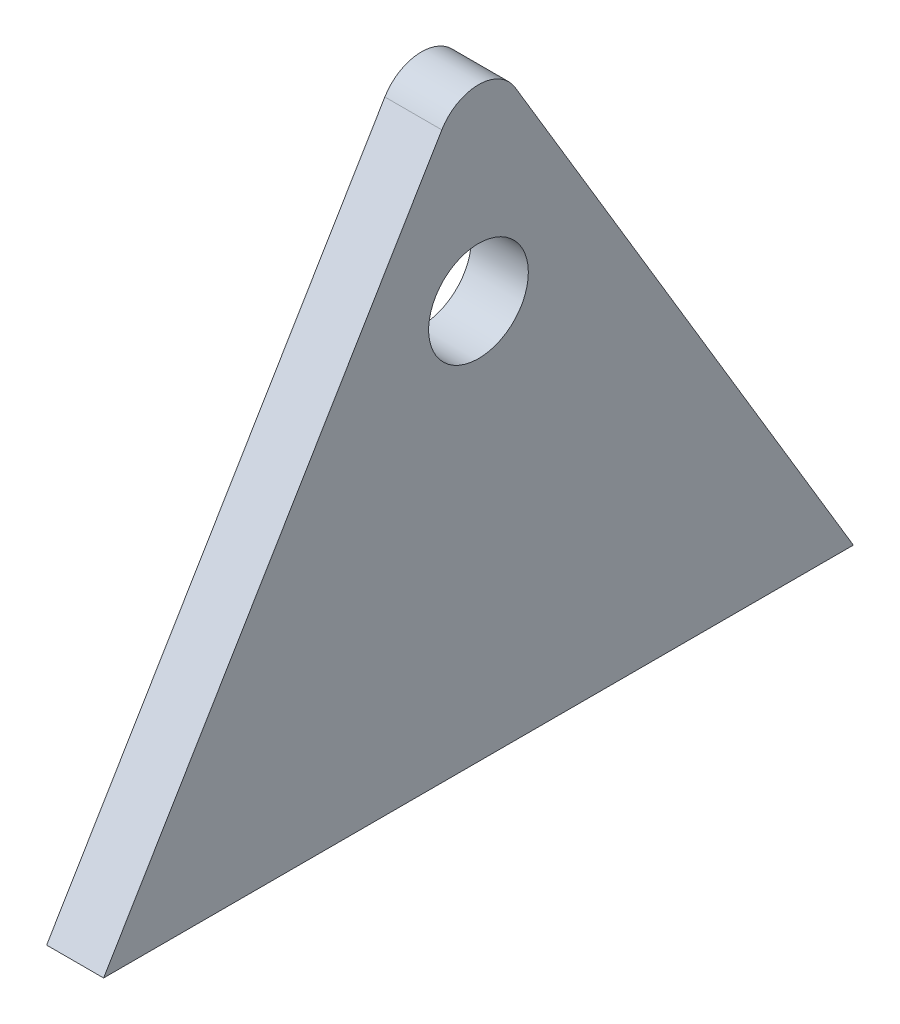
from build123d import *

# Parameters (mm, degrees)
BOSS_EXTRUDE1_DEPTH     = 12.7
FILLET1_R               = 9.525
CUT_EXTRUDE3_DEPTH      = 156.624193753
CUT_EXTRUDE3_DEPTH_BACK = 156.624193753
SKETCH2_R               = 11.1125


with BuildPart() as part:
    # Sketch1 → Boss-Extrude1 (new body)
    with BuildSketch(Plane(origin=(0, 0, 0), x_dir=(0, 0, -1), z_dir=(1, 0, 0))):
        Polygon((0, 139.7), (-83.564031322, 0), (83.564031322, 0), align=None)
    extrude(amount=BOSS_EXTRUDE1_DEPTH)

    # Fillet1
    fillet1_edges = [part.edges().sort_by_distance(p)[0] for p in [
        (6.35, 139.7, 0),
    ]]
    fillet(fillet1_edges, radius=FILLET1_R)

    # Sketch2 → Cut-Extrude3 (cut, two sides: drawn at the far end of the back side and taken through both)
    with BuildSketch(Plane(origin=(0, 0, 0), x_dir=(0, 0, -1), z_dir=(1, 0, 0)).offset(-CUT_EXTRUDE3_DEPTH_BACK)):
        with Locations((0, 88.9)):
            Circle(SKETCH2_R)
    extrude(amount=CUT_EXTRUDE3_DEPTH + CUT_EXTRUDE3_DEPTH_BACK, mode=Mode.SUBTRACT)


solid = part.part
